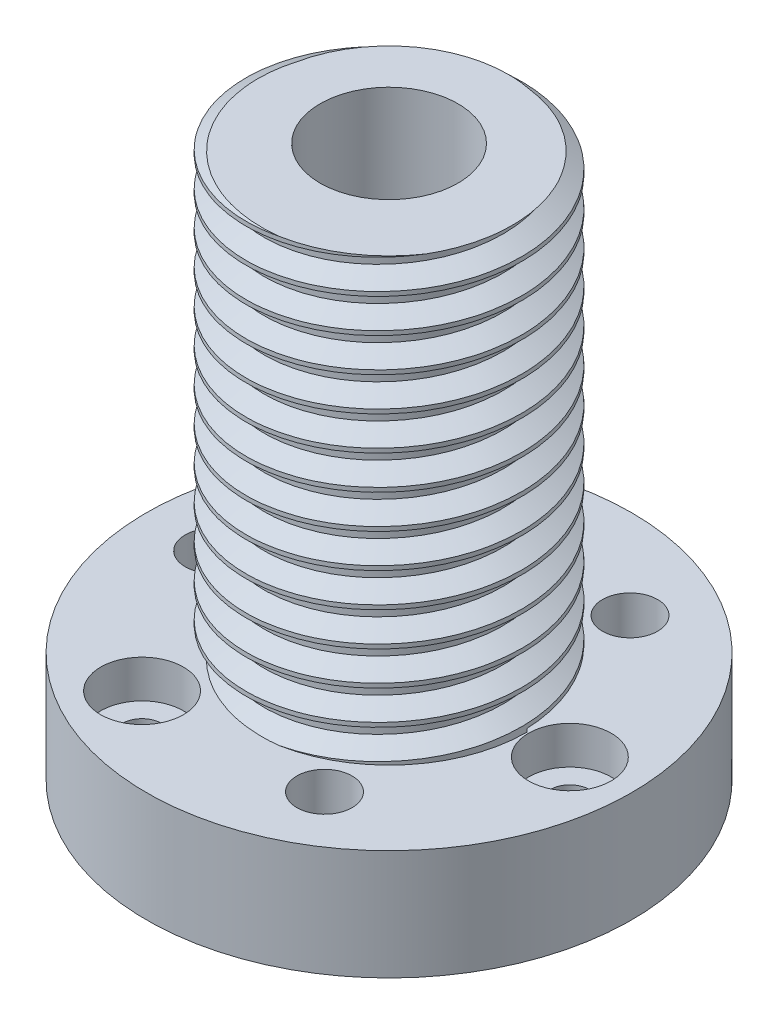
from build123d import *

# Parameters (mm, degrees)
SKETCH1_R                                      = 7.9375
BOSS_EXTRUDE1_DEPTH                            = 25.4
SKETCH2_R                                      = 13.97
BOSS_EXTRUDE2_DEPTH                            = 6.35
SKETCH3_R                                      = 3.96875
CUT_EXTRUDE1_DEPTH                             = 19.05
CBORE_FOR_2_SOCKET_HEAD_CAP_SCREW1_D           = 2.2606
CBORE_FOR_2_SOCKET_HEAD_CAP_SCREW1_CBORE_D     = 4.7625
CBORE_FOR_2_SOCKET_HEAD_CAP_SCREW1_CBORE_DEPTH = 2.1844
CIRPATTERN1_COUNT                              = 3
THREAD1_PITCH                                  = 1.953846154
THREAD1_FROM                                   = 1.524
SKETCH19_R                                     = 0.79375
CUT_EXTRUDE3_DEPTH                             = 11.43
TAP_DRILL_FOR_0_80_TAP2_D                      = 1.19126
TAP_DRILL_FOR_0_80_TAP2_DEPTH                  = 6.35
TAP_DRILL_FOR_0_80_TAP2_TIP                    = 0.499792913
SKETCH24_R                                     = 1.5875
CUT_EXTRUDE4_DEPTH                             = 33.178903192
CIRPATTERN3_COUNT                              = 3


with BuildPart() as part:
    # Sketch1 → Boss-Extrude1 (new body)
    with BuildSketch(Plane(origin=(0, 0, 0), x_dir=(1, 0, 0), z_dir=(0, 1, 0))):
        with Locations(Location((0, 0, 0), (0, 0, 270))):
            Circle(SKETCH1_R)
    extrude(amount=BOSS_EXTRUDE1_DEPTH)

    # Sketch2 → Boss-Extrude2 (add)
    with BuildSketch(Plane(origin=(0, 0, 0), x_dir=(-1, 0, 0), z_dir=(0, -1, 0))):
        with Locations(Location((0, 0, 0), (0, 0, 90))):
            Circle(SKETCH2_R)
    extrude(amount=BOSS_EXTRUDE2_DEPTH)

    # Sketch3 → Cut-Extrude1 (cut)
    with BuildSketch(Plane(origin=(0, 25.4, 0), x_dir=(1, 0, 0), z_dir=(0, 1, 0))):
        with Locations(Location((0, 0, 0), (0, 0, 270))):
            Circle(SKETCH3_R)
    extrude(amount=-CUT_EXTRUDE1_DEPTH, mode=Mode.SUBTRACT)

    # CBORE for #2 Socket Head Cap Screw1 (through all)
    with Locations(Plane(origin=(0, 0, 0), x_dir=(1, 0, 0), z_dir=(0, 1, 0))):
        with Locations((10.414, 0)):
            cbore_for_2_socket_head_cap_screw1 = CounterBoreHole(CBORE_FOR_2_SOCKET_HEAD_CAP_SCREW1_D / 2, CBORE_FOR_2_SOCKET_HEAD_CAP_SCREW1_CBORE_D / 2, CBORE_FOR_2_SOCKET_HEAD_CAP_SCREW1_CBORE_DEPTH)

    # CirPattern1: CBORE for #2 Socket Head Cap Screw1 ×3 about axis
    cirpattern1_axis = Axis((0, 0, 0), (0, 1, 0))
    for i in range(1, CIRPATTERN1_COUNT):
        add(cbore_for_2_socket_head_cap_screw1.rotate(cirpattern1_axis, i * 360 / CIRPATTERN1_COUNT), mode=Mode.SUBTRACT)

    # Thread1: arcs per turn and ends read off the stored shape
    # Thread1: the profile of Thread Profile1 profile screwed along a right-hand helix through 13.78 turns, 10 arcs to a turn; built about Z, then put on its axis
    thread1_z = Axis((0, 0, 0), (0, 0, 1))
    thread1_corners = [(7.9378, 0, -0.000173205), (7.9378, 0, 1.709788584), (6.879949752, 0, 1.099038459), (6.879949752, 0, 0.61057692)]
    with BuildLine(mode=Mode.PRIVATE) as thread1_profile:
        Line(thread1_corners[0], thread1_corners[1])
        Line(thread1_corners[1], thread1_corners[2])
        Line(thread1_corners[2], thread1_corners[3])
        Line(thread1_corners[3], thread1_corners[0])
    thread1_cap = Face(thread1_profile.wire())
    thread1_turn_angles = [0, 18, 36, 54, 72, 90, 108, 126, 144, 162, 180, 198, 216, 234, 252, 270, 288, 306, 324, 342, 360]
    thread1_turn_weights = [1, 0.9510565162951535, 1, 0.9510565162951535, 1, 0.9510565162951535, 1, 0.9510565162951535, 1, 0.9510565162951535, 1, 0.9510565162951535, 1, 0.9510565162951535, 1, 0.9510565162951535, 1, 0.9510565162951535, 1, 0.9510565162951535, 1]
    thread1_turn_rails = [Edge.make_bspline([Vector(p[0], p[1], 0).rotate(thread1_z, thread1_turn_angles[k]) / thread1_turn_weights[k] + Vector(0, 0, p[2] + THREAD1_PITCH * thread1_turn_angles[k] / 360) for k in range(21)], [0, 0, 0, 1, 1, 2, 2, 3, 3, 4, 4, 5, 5, 6, 6, 7, 7, 8, 8, 9, 9, 10, 10, 10], 2, thread1_turn_weights) for p in thread1_corners]
    thread1_turn_sides = [Face.make_surface_from_curves(thread1_turn_rails[p[0]], thread1_turn_rails[p[1]]) for p in [(0, 1), (1, 2), (2, 3), (3, 0)]]
    thread1_last_angles = [4680, 4698, 4716, 4734, 4752, 4770, 4788, 4806, 4824, 4842, 4860, 4878, 4896, 4914, 4932, 4946.4, 4960.8]
    thread1_last_weights = [1, 0.9510565162951535, 1, 0.9510565162951535, 1, 0.9510565162951535, 1, 0.9510565162951535, 1, 0.9510565162951535, 1, 0.9510565162951535, 1, 0.9510565162951535, 1, 0.9685831611286327, 1]
    thread1_last_rails = [Edge.make_bspline([Vector(p[0], p[1], 0).rotate(thread1_z, thread1_last_angles[k]) / thread1_last_weights[k] + Vector(0, 0, p[2] + THREAD1_PITCH * thread1_last_angles[k] / 360) for k in range(17)], [0, 0, 0, 1, 1, 2, 2, 3, 3, 4, 4, 5, 5, 6, 6, 7, 7, 8, 8, 8], 2, thread1_last_weights) for p in thread1_corners]
    thread1_last_sides = [Face.make_surface_from_curves(thread1_last_rails[p[0]], thread1_last_rails[p[1]]) for p in [(0, 1), (1, 2), (2, 3), (3, 0)]]
    thread1 = Plane(origin=(0, -1.524, 0), x_dir=(1, 0, 0), z_dir=(0, 1, 0)) * split(Solid(Shell([*[p.moved(Location((0, 0, THREAD1_PITCH * i))) for i in range(13) for p in thread1_turn_sides], *thread1_last_sides, thread1_cap, thread1_cap.rotate(thread1_z, 4960.8).moved(Location((0, 0, THREAD1_PITCH * 4960.8 / 360)))])), bisect_by=Plane.XY.offset(THREAD1_FROM), keep=Keep.TOP, mode=Mode.PRIVATE)
    add(thread1, mode=Mode.SUBTRACT)

    # Sketch19 → Cut-Extrude3 (cut)
    with BuildSketch(Plane.XZ.offset(6.35)):
        with Locations(Location((0, 0, 0), (0, 0, 270))):
            Circle(SKETCH19_R)
    extrude(amount=-CUT_EXTRUDE3_DEPTH, mode=Mode.SUBTRACT)

    # Tap Drill for #0-80 Tap2
    with Locations(Plane(origin=(0, -6.35, 0), x_dir=(-1, 0, 0), z_dir=(0, -1, 0))):
        with Locations((0, -1.905), (0, 1.905)):
            Hole(TAP_DRILL_FOR_0_80_TAP2_D / 2, depth=TAP_DRILL_FOR_0_80_TAP2_DEPTH)
            with Locations((0, 0, -(TAP_DRILL_FOR_0_80_TAP2_DEPTH + TAP_DRILL_FOR_0_80_TAP2_TIP / 2))):  # 100° drill point
                Cone(0, TAP_DRILL_FOR_0_80_TAP2_D / 2, TAP_DRILL_FOR_0_80_TAP2_TIP, mode=Mode.SUBTRACT)

    # Sketch24 → Cut-Extrude4 (cut, through all)
    with BuildSketch(Plane(origin=(0, 0, 0), x_dir=(1, 0, 0), z_dir=(0, 1, 0))):
        with Locations(Location((-10.16, 0, 0), (0, 0, 270))):
            Circle(SKETCH24_R)
    cut_extrude4 = extrude(amount=-CUT_EXTRUDE4_DEPTH, mode=Mode.SUBTRACT)

    # CirPattern3: Cut-Extrude4 ×3 about axis
    cirpattern3_axis = Axis((0, 0, 0), (0, 1, 0))
    for i in range(1, CIRPATTERN3_COUNT):
        add(cut_extrude4.rotate(cirpattern3_axis, i * 360 / CIRPATTERN3_COUNT), mode=Mode.SUBTRACT)


solid = part.part
